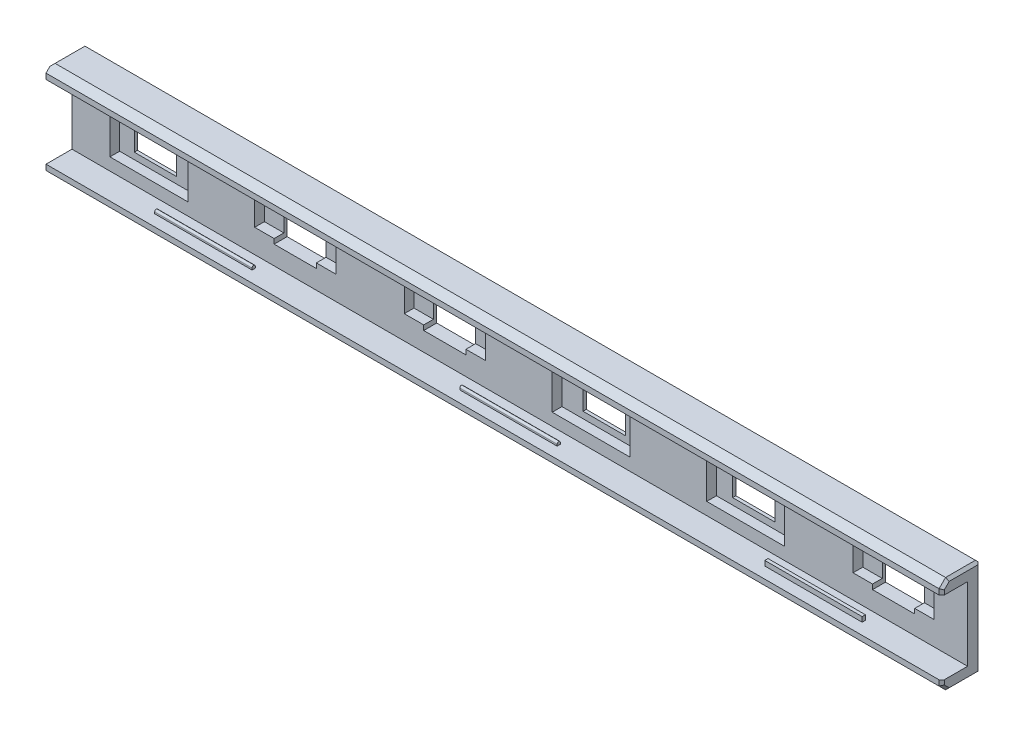
from build123d import *

# Parameters (mm, degrees)
SKETCH1_W               = 138
SKETCH1_H               = 15
BOSS_EXTRUDE1_DEPTH     = 6
CUT_EXTRUDE1_DEPTH      = 96.457872636
CUT_EXTRUDE1_DEPTH_BACK = 96.457872636
SKETCH2_W               = 6.5
SKETCH2_H               = 5.5
CUT_EXTRUDE2_DEPTH      = 96.457872636
CUT_EXTRUDE2_DEPTH_BACK = 96.457872636
SKETCH3_W               = 6.5
SKETCH3_H               = 5.5
CUT_EXTRUDE3_DEPTH      = 96.457872636
CUT_EXTRUDE3_DEPTH_BACK = 96.457872636
SKETCH4_W               = 6.5
SKETCH4_H               = 5.5
CUT_EXTRUDE4_DEPTH      = 96.457872636
CUT_EXTRUDE4_DEPTH_BACK = 96.457872636
SKETCH5_W               = 6.5
SKETCH5_H               = 5.5
CUT_EXTRUDE5_DEPTH      = 96.457872636
CUT_EXTRUDE5_DEPTH_BACK = 4
SKETCH8_W               = 138
SKETCH8_H               = 11.3
SKETCH9_W               = 12
SKETCH9_H               = 7.5
SKETCH9_W_2             = 12.5
SKETCH9_H_2             = 4
CUT_EXTRUDE6_DEPTH      = 1.5
SKETCH10_W              = 12.5
SKETCH10_H              = 4
CUT_EXTRUDE7_DEPTH      = 1.5
CUT_EXTRUDE8_DEPTH      = 138
SKETCH13_W              = 0.5
SKETCH13_H              = 10
CUT_EXTRUDE9_DEPTH      = 0.6
FILLET1_R               = 0.25
FILLET2_R               = 0.25
SKETCH16_W              = 15
SKETCH16_H              = 0.5
BOSS_EXTRUDE2_DEPTH     = 0.75
FILLET3_R               = 0.5
FILLET4_R               = 0.25
SKETCH17_W              = 15
SKETCH17_H              = 0.5
BOSS_EXTRUDE3_DEPTH     = 0.75
FILLET5_R               = 0.5
FILLET6_R               = 0.25
LPATTERN1_COUNT         = 3
LPATTERN1_PITCH         = 47
LPATTERN2_COUNT         = 3
LPATTERN2_PITCH         = 47
FILLET7_R               = 0.5
FILLET8_R               = 0.25
FILLET9_R               = 0.5
FILLET10_R              = 0.25
CHAMFER1_SIZE           = 0.4
CHAMFER2_SIZE           = 0.4
CHAMFER3_SIZE           = 0.4
CHAMFER5_SIZE           = 0.4


# Some blends are built 0.0001 mm under size
with BuildPart() as part:
    # Sketch1 → Boss-Extrude1 (new body)
    with BuildSketch(Plane.XY):
        with Locations((-22.75, 18.154296875)):
            Rectangle(SKETCH1_W, SKETCH1_H)
    extrude(amount=BOSS_EXTRUDE1_DEPTH)

    # Sketch2 → Cut-Extrude1 (cut, two sides: drawn at the far end of the back side and taken through both)
    with BuildSketch(Plane.XY.offset(6).offset(-CUT_EXTRUDE1_DEPTH_BACK)):
        with Locations((-80.4, 18.154296875)):
            Rectangle(SKETCH2_W, SKETCH2_H)
    extrude(amount=CUT_EXTRUDE1_DEPTH + CUT_EXTRUDE1_DEPTH_BACK, mode=Mode.SUBTRACT)

    # Sketch3 → Cut-Extrude2 (cut, two sides: drawn at the far end of the back side and taken through both)
    with BuildSketch(Plane.XY.offset(6).offset(-CUT_EXTRUDE2_DEPTH_BACK)):
        with Locations((-57.35, 18.154296875)):
            Rectangle(SKETCH3_W, SKETCH3_H)
    extrude(amount=CUT_EXTRUDE2_DEPTH + CUT_EXTRUDE2_DEPTH_BACK, mode=Mode.SUBTRACT)

    # Sketch4 → Cut-Extrude3 (cut, two sides: drawn at the far end of the back side and taken through both)
    with BuildSketch(Plane.XY.offset(6).offset(-CUT_EXTRUDE3_DEPTH_BACK)):
        with Locations((-34.3, 18.154296875)):
            Rectangle(SKETCH4_W, SKETCH4_H)
    extrude(amount=CUT_EXTRUDE3_DEPTH + CUT_EXTRUDE3_DEPTH_BACK, mode=Mode.SUBTRACT)

    # Sketch5 → Cut-Extrude4 (cut, two sides: drawn at the far end of the back side and taken through both)
    with BuildSketch(Plane.XY.offset(6).offset(-CUT_EXTRUDE4_DEPTH_BACK)):
        with Locations((-11.25, 18.154296875)):
            Rectangle(SKETCH5_W, SKETCH5_H)
        with Locations((11.8, 18.154296875)):
            Rectangle(SKETCH5_W, SKETCH5_H)
        with Locations((34.85, 18.154296875)):
            Rectangle(SKETCH5_W, SKETCH5_H)
    extrude(amount=CUT_EXTRUDE4_DEPTH + CUT_EXTRUDE4_DEPTH_BACK, mode=Mode.SUBTRACT)

    # Sketch8 → Cut-Extrude5 (cut, two sides: drawn at the far end of the back side and taken through both)
    with BuildSketch(Plane.XY.offset(6).offset(-CUT_EXTRUDE5_DEPTH_BACK)):
        with Locations((-22.75, 18.154296875)):
            Rectangle(SKETCH8_W, SKETCH8_H)
    extrude(amount=CUT_EXTRUDE5_DEPTH + CUT_EXTRUDE5_DEPTH_BACK, mode=Mode.SUBTRACT)

    # Sketch9 → Cut-Extrude6 (cut)
    with BuildSketch(Plane.XY.offset(2)):
        with Locations((-11.75, 18.154296875)):
            Rectangle(SKETCH9_W, SKETCH9_H)
        with Locations((12.05, 18.154296875)):
            Rectangle(SKETCH9_W, SKETCH9_H)
        with Locations((-79.9, 18.154296875)):
            Rectangle(SKETCH9_W, SKETCH9_H)
        with Locations((34.85, 18.154296875)):
            Rectangle(SKETCH9_W_2, SKETCH9_H_2)
    extrude(amount=-CUT_EXTRUDE6_DEPTH, mode=Mode.SUBTRACT)

    # Sketch10 → Cut-Extrude7 (cut)
    with BuildSketch(Plane.XY.offset(2)):
        with Locations((-34.3, 18.154296875)):
            Rectangle(SKETCH10_W, SKETCH10_H)
        with Locations((-57.35, 18.154296875)):
            Rectangle(SKETCH10_W, SKETCH10_H)
    extrude(amount=-CUT_EXTRUDE7_DEPTH, mode=Mode.SUBTRACT)

    # Sketch12 → Cut-Extrude8 (cut)
    with BuildSketch(Plane(origin=(46.25, 0, 0), x_dir=(0, 0, -1), z_dir=(1, 0, 0))):
        Polygon((-6, 25.654296875), (-6, 24.654296875), (-5, 25.654296875), align=None)
        Polygon((-6, 10.654296875), (-5, 10.654296875), (-6, 11.654296875), align=None)
    extrude(amount=-CUT_EXTRUDE8_DEPTH, mode=Mode.SUBTRACT)

    # Sketch13 → Cut-Extrude9 (cut)
    with BuildSketch(Plane(origin=(0, 0, 0), x_dir=(-1, 0, 0), z_dir=(0, 0, -1))):
        with Locations((89.5, 18.154296875)):
            Rectangle(SKETCH13_W, SKETCH13_H)
    extrude(amount=-CUT_EXTRUDE9_DEPTH, mode=Mode.SUBTRACT)

    # Fillet1
    fillet1_edges = [part.edges().sort_by_distance(p)[0] for p in [
        (-89.75, 18.154296875, 0),
    ]]
    fillet(fillet1_edges, radius=FILLET1_R)

    # Fillet2
    fillet2_edges = [part.edges().sort_by_distance(p)[0] for p in [
        (-89.25, 18.154296875, 0.6),
        (-89.5, 23.154296875, 0.6),
        (-89.75, 18.154296875, 0.6),
        (-89.5, 13.154296875, 0.6),
    ]]
    fillet(fillet2_edges, radius=FILLET2_R - 0.0001)  # a hair under: the kernel refuses the full size

    # Sketch16 → Boss-Extrude2 (add)
    with BuildSketch(Plane.XZ.offset(-23.804296875)):
        with Locations((-69.25, 4)):
            Rectangle(SKETCH16_W, SKETCH16_H)
    boss_extrude2 = extrude(amount=BOSS_EXTRUDE2_DEPTH)

    # Fillet3
    fillet3_edges = [part.edges().sort_by_distance(p)[0] for p in [
        (-69.25, 23.054296875, 4.25),
    ]]
    fillet(fillet3_edges, radius=FILLET3_R - 0.0001)  # a hair under: the kernel refuses the full size

    # Fillet4
    # the kernel refuses this fillet: 0.25 mm, written as the material it takes off along each edge
    with BuildSketch(Plane(origin=(-78.517583771, 23.054296875, 3.75), x_dir=(0, 0.7070334963750315, 0.7071800584035852), z_dir=(1, 0, 0))) as fillet4_piece_1:
        with BuildLine():
            CenterArc((0.530239778, -0.176759656), FILLET4_R, 44.994477546, 179.999584605)
            Line((0.353444764, -0.35351803), (0.335765262, -0.371193867))
            Line((0.335765262, -0.371193867), (-0.017679501, -0.017675837))
            Line((-0.017679501, -0.017675837), (-0.017675837, 0.017679501))
            ThreePointArc((-0.017675837, 0.017679501), (-0.017605119, 0.017750205), (0.724712885, 0.017675966))
            Line((0.724712885, 0.017675966), (0.707033512, 0))
        make_face()
    extrude(amount=18.535167542, mode=Mode.SUBTRACT)

    # Sketch17 → Boss-Extrude3 (add)
    with BuildSketch(Plane(origin=(0, 12.504296875, 0), x_dir=(1, 0, 0), z_dir=(0, 1, 0))):
        with Locations((-69.25, -4)):
            Rectangle(SKETCH17_W, SKETCH17_H)
    boss_extrude3 = extrude(amount=BOSS_EXTRUDE3_DEPTH)

    # Fillet5
    fillet5_edges = [part.edges().sort_by_distance(p)[0] for p in [
        (-69.25, 13.254296875, 4.25),
    ]]
    fillet(fillet5_edges, radius=FILLET5_R - 0.0001)  # a hair under: the kernel refuses the full size

    # Fillet6
    # the kernel refuses this fillet: 0.25 mm, written as the material it takes off along each edge
    with BuildSketch(Plane(origin=(-59.982416237, 13.254296875, 3.75), x_dir=(0, -0.707033490014658, 0.7071800647626406), z_dir=(-1, 0, 0))) as fillet6_piece_1:
        with BuildLine():
            CenterArc((0.530239774, -0.176759657), FILLET6_R, 44.994478062, 179.999583575)
            Line((0.353444757, -0.35351803), (0.335765256, -0.371193867))
            Line((0.335765256, -0.371193867), (-0.017679502, -0.017675837))
            Line((-0.017679502, -0.017675837), (-0.017675837, 0.017679502))
            ThreePointArc((-0.017675837, 0.017679502), (-0.017605119, 0.017750205), (0.724712878, 0.017675966))
            Line((0.724712878, 0.017675966), (0.707033505, 0))
        make_face()
    extrude(amount=18.535167526, mode=Mode.SUBTRACT)

    # LPattern1: Boss-Extrude3 ×3
    with Locations(*[(i * LPATTERN1_PITCH, 0, 0) for i in range(1, LPATTERN1_COUNT)]):
        add(boss_extrude3)

    # LPattern2: Boss-Extrude2 ×3
    with Locations(*[(i * LPATTERN2_PITCH, 0, 0) for i in range(1, LPATTERN2_COUNT)]):
        add(boss_extrude2)

    # Fillet7
    fillet7_edges = [part.edges().sort_by_distance(p)[0] for p in [
        (-22.25, 23.054296875, 4.25),
    ]]
    fillet(fillet7_edges, radius=FILLET7_R - 0.0001)  # a hair under: the kernel refuses the full size

    # Fillet8
    # the kernel refuses this fillet: 0.25 mm, written as the material it takes off along each edge
    with BuildSketch(Plane(origin=(-31.517583771, 23.054296875, 3.75), x_dir=(0, 0.7070334900866685, 0.707180064690645), z_dir=(1, 0, 0))) as fillet8_piece_1:
        with BuildLine():
            CenterArc((0.530239774, -0.176759657), FILLET8_R, 44.994478056, 179.999583586)
            Line((0.353444758, -0.35351803), (0.335765256, -0.371193867))
            Line((0.335765256, -0.371193867), (-0.017679502, -0.017675837))
            Line((-0.017679502, -0.017675837), (-0.017675837, 0.017679502))
            ThreePointArc((-0.017675837, 0.017679502), (-0.017605119, 0.017750205), (0.724712878, 0.017675966))
            Line((0.724712878, 0.017675966), (0.707033505, 0))
        make_face()
    extrude(amount=18.535167542, mode=Mode.SUBTRACT)

    # Fillet9
    fillet9_edges = [part.edges().sort_by_distance(p)[0] for p in [
        (-22.25, 13.254296875, 4.25),
    ]]
    fillet(fillet9_edges, radius=FILLET9_R - 0.0001)  # a hair under: the kernel refuses the full size

    # Fillet10
    # the kernel refuses this fillet: 0.25 mm, written as the material it takes off along each edge
    with BuildSketch(Plane(origin=(-12.982416233, 13.254296875, 3.75), x_dir=(0, -0.7070334900159922, 0.7071800647613065), z_dir=(-1, 0, 0))) as fillet10_piece_1:
        with BuildLine():
            CenterArc((0.530239774, -0.176759657), FILLET10_R, 44.994478062, 179.999583575)
            Line((0.353444757, -0.35351803), (0.335765256, -0.371193867))
            Line((0.335765256, -0.371193867), (-0.017679502, -0.017675837))
            Line((-0.017679502, -0.017675837), (-0.017675837, 0.017679502))
            ThreePointArc((-0.017675837, 0.017679502), (-0.017605119, 0.017750205), (0.724712878, 0.017675966))
            Line((0.724712878, 0.017675966), (0.707033505, 0))
        make_face()
    extrude(amount=18.535167534, mode=Mode.SUBTRACT)

    # Chamfer1
    chamfer1_edges = [part.edges().sort_by_distance(p)[0] for p in [
        (-22.75, 25.654296875, 0),
        (-22.75, 10.654296875, 0),
    ]]
    chamfer(chamfer1_edges, length=CHAMFER1_SIZE)

    # Chamfer2
    chamfer2_edges = [part.edges().sort_by_distance(p)[0] for p in [
        (46.25, 18.154296875, 0),
        (-91.75, 18.154296875, 0),
    ]]
    chamfer(chamfer2_edges, length=CHAMFER2_SIZE)

    # Chamfer3
    chamfer3_edges = [part.edges().sort_by_distance(p)[0] for p in [
        (-91.75, 25.654296875, 2.7),
        (-91.75, 10.654296875, 2.7),
    ]]
    chamfer(chamfer3_edges, length=CHAMFER3_SIZE)

    # Chamfer5
    chamfer5_edges = [part.edges().sort_by_distance(p)[0] for p in [
        (46.25, 24.229296875, 6),
        (46.25, 25.654296875, 2.7),
        (46.25, 10.654296875, 2.7),
        (46.25, 12.079296875, 6),
        (46.25, 25.154296875, 5.5),
        (46.25, 11.154296875, 5.5),
    ]]
    chamfer(chamfer5_edges, length=CHAMFER5_SIZE)


solid = part.part
